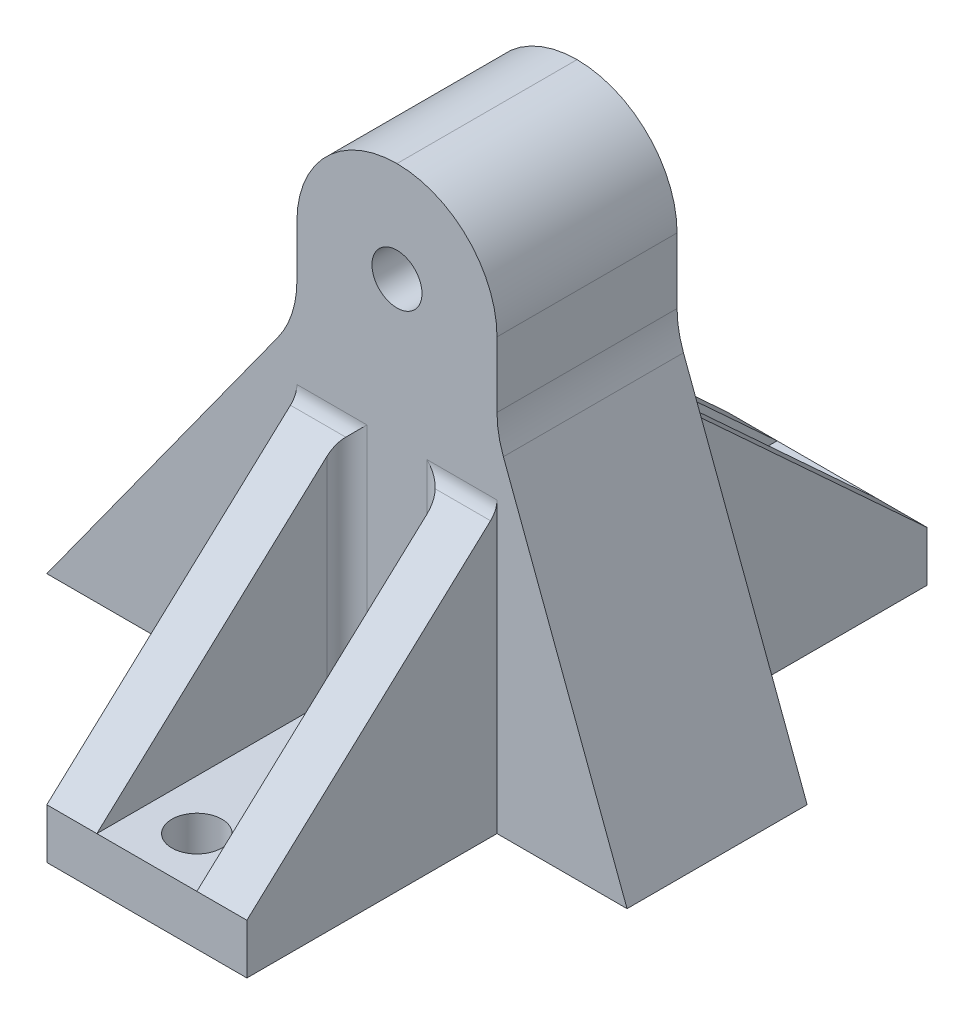
from build123d import *

# Parameters (mm, degrees)
SKETCH1_W                = 20
SKETCH1_H                = 53
SKETCH1_R                = 2.5
BOSS_EXTRUDE1_DEPTH      = 18
FILLET1_R                = 10
BOSS_EXTRUDE2_DEPTH      = 18
BOSS_EXTRUDE3_DEPTH      = 43
BOSS_EXTRUDE3_DEPTH_BACK = 25
SKETCH3_W                = 20
SKETCH3_H                = 5
RIB8_REACH               = 69.365
SKETCH6_WALL_W           = 170.699933848
SKETCH6_WALL_H           = 5
RIB9_REACH               = 69.365
SKETCH7_WALL_W           = 170.699933848
SKETCH7_WALL_H           = 5
CUT_EXTRUDE1_DEPTH       = 69.366658541
CUT_EXTRUDE1_DEPTH_BACK  = 69.366658541
SKETCH8_R                = 2.5
SKETCH8_R_2              = 7.5
FILLET3_R                = 10
FILLET4_R                = 2


with BuildPart() as part:
    # Sketch1 → Boss-Extrude1 (new body)
    with BuildSketch(Plane.XY):
        with Locations((0, 13.5)):
            Rectangle(SKETCH1_W, SKETCH1_H)
        with Locations((0, 30)):
            Circle(SKETCH1_R, mode=Mode.SUBTRACT)
    extrude(amount=BOSS_EXTRUDE1_DEPTH)

    # Fillet1
    fillet1_edges = [part.edges().sort_by_distance(p)[0] for p in [
        (-10, 40, 9),
        (10, 40, 9),
    ]]
    fillet(fillet1_edges, radius=FILLET1_R - 0.0001)  # a hair under: the kernel refuses the full size

    # Sketch2 → Boss-Extrude2 (add)
    with BuildSketch(Plane.XY):
        Polygon((-10, 21.641016151), (-35, -13), (-10, -13), align=None)
        Polygon((10, 21.641016151), (10, -13), (23, -13), align=None)
    extrude(amount=BOSS_EXTRUDE2_DEPTH)

    # Sketch3 → Boss-Extrude3 (add, two sides: drawn at the far end of the back side and taken through both)
    with BuildSketch(Plane.XY.offset(-BOSS_EXTRUDE3_DEPTH_BACK)):
        with Locations((0, -10.5)):
            Rectangle(SKETCH3_W, SKETCH3_H)
    extrude(amount=BOSS_EXTRUDE3_DEPTH + BOSS_EXTRUDE3_DEPTH_BACK)

    # Sketch6 wall → Rib8 (add, up to next)
    with BuildSketch(Plane(origin=(-10, 3.5, -12.5), x_dir=(0, 0.677056530821, 0.735931011762), z_dir=(0, 0.735931011762, -0.677056530821)), mode=Mode.PRIVATE) as rib8_sk1:
        with Locations((0, 2.5)):
            Rectangle(SKETCH6_WALL_W, SKETCH6_WALL_H)
    rib8_tool1 = extrude(rib8_sk1.sketch, amount=-RIB8_REACH, mode=Mode.PRIVATE) - part.part
    rib8 = rib8_tool1.solids().sort_by_distance((-10, 3.5, -12.5))[0]
    add(rib8)

    # Sketch7 wall → Rib9 (add, up to next)
    with BuildSketch(Plane(origin=(-10, 3.5, 30.5), x_dir=(0, -0.677056530821, 0.735931011762), z_dir=(0, 0.735931011762, 0.677056530821)), mode=Mode.PRIVATE) as rib9_sk1:
        with Locations((0, 2.5)):
            Rectangle(SKETCH7_WALL_W, SKETCH7_WALL_H)
    rib9_tool1 = extrude(rib9_sk1.sketch, amount=-RIB9_REACH, mode=Mode.PRIVATE) - part.part
    rib9 = rib9_tool1.solids().sort_by_distance((-10, 3.5, 30.5))[0]
    add(rib9)

    # Mirror1: Rib8, Rib9 across plane
    add(rib8.mirror(Plane(origin=(0, 0, 0), x_dir=(0, 0, 1), z_dir=(1, 0, 0))))
    add(rib9.mirror(Plane(origin=(0, 0, 0), x_dir=(0, 0, 1), z_dir=(1, 0, 0))))

    # Sketch8 → Cut-Extrude1 (cut, two sides: drawn at the far end of the back side and taken through both)
    with BuildSketch(Plane(origin=(0, 0, 0), x_dir=(1, 0, 0), z_dir=(0, 1, 0)).offset(-CUT_EXTRUDE1_DEPTH_BACK)):
        with Locations(Location((0, 20, 0), (0, 0, 270))):
            Circle(SKETCH8_R)
        with Locations(Location((0, -38, 0), (0, 0, 270))):
            Circle(SKETCH8_R)
        with Locations(Location((-22.5, -9, 0), (0, 0, 270))):
            Circle(SKETCH8_R_2)
    extrude(amount=CUT_EXTRUDE1_DEPTH + CUT_EXTRUDE1_DEPTH_BACK, mode=Mode.SUBTRACT)

    # Fillet3
    fillet3_edges = [part.edges().sort_by_distance(p)[0] for p in [
        (-10, 21.641016151, 9),
        (10, 21.641016151, 9),
    ]]
    fillet(fillet3_edges, radius=FILLET3_R)

    # Fillet4
    fillet4_edges = [part.edges().sort_by_distance(p)[0] for p in [
        (-5, 3.5, 18),
        (-7.5, 15, 18),
        (0, -8, 0),
        (7.5, 15, 0),
        (5, 3.5, 0),
        (0, -8, 18),
        (5, 3.5, 18),
        (7.5, 15, 18),
        (-7.5, 15, 0),
        (-5, 3.5, 0),
    ]]
    fillet(fillet4_edges, radius=FILLET4_R)


solid = part.part
